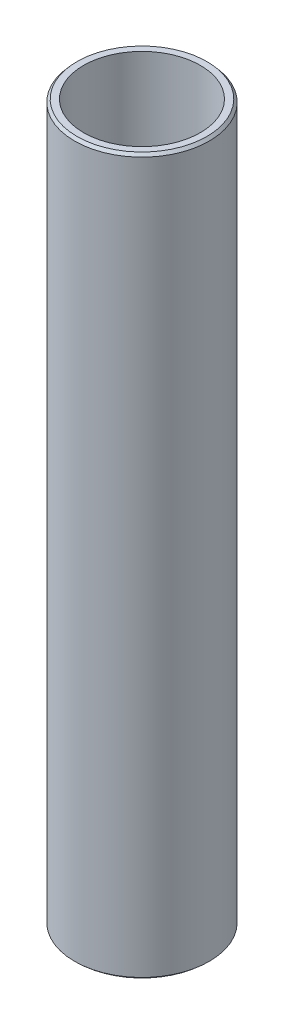
from build123d import *
from OCP.BRepFilletAPI import BRepFilletAPI_MakeChamfer

# Parameters (mm, degrees)
SKETCH1_R           = 55
BOSS_EXTRUDE1_DEPTH = 584.367279121
SKETCH2_R           = 47.669731786
CUT_EXTRUDE1_DEPTH  = 590.521091147
CHAMFER1_SIZE       = 2.240028075
CHAMFER1_SIZE2      = 1.967390498


with BuildPart() as part:
    # Sketch1 → Boss-Extrude1 (new body)
    with BuildSketch(Plane(origin=(0, 0, 0), x_dir=(1, 0, 0), z_dir=(0, 1, 0))):
        Circle(SKETCH1_R)
    extrude(amount=BOSS_EXTRUDE1_DEPTH)

    # Sketch2 → Cut-Extrude1 (cut, through all)
    with BuildSketch(Plane(origin=(0, 0, 0), x_dir=(1, 0, 0), z_dir=(0, 1, 0))):
        Circle(SKETCH2_R)
    extrude(amount=CUT_EXTRUDE1_DEPTH, mode=Mode.SUBTRACT)

    # Chamfer1: one chamfer whose edges measure the first distance from different faces: ONE call of the kernel's chamfer builder (chamfer() names one face for all edges)
    chamfer1_edges_1 = [part.edges().sort_by_distance(p)[0] for p in [
        (-55, 584.367279121, 0),
    ]]
    chamfer1_side_1 = [part.faces().sort_by_distance(p)[0] for p in [
        (-55, 292.18363956, 0),
    ]]
    chamfer1_edges_2 = [part.edges().sort_by_distance(p)[0] for p in [
        (-55, 0, 0),
    ]]
    chamfer1_side_2 = [part.faces().sort_by_distance(p)[0] for p in [
        (-53.444365081, 0, 0),
    ]]
    chamfer1 = BRepFilletAPI_MakeChamfer(part.part.solid().wrapped)
    for e in chamfer1_edges_1:
        chamfer1.Add(CHAMFER1_SIZE, CHAMFER1_SIZE2, e.wrapped, chamfer1_side_1[0].wrapped)  # the first distance lies on this face
    for e in chamfer1_edges_2:
        chamfer1.Add(CHAMFER1_SIZE, CHAMFER1_SIZE2, e.wrapped, chamfer1_side_2[0].wrapped)  # the first distance lies on this face
    add(Compound.cast(chamfer1.Shape()), mode=Mode.REPLACE)


solid = part.part
